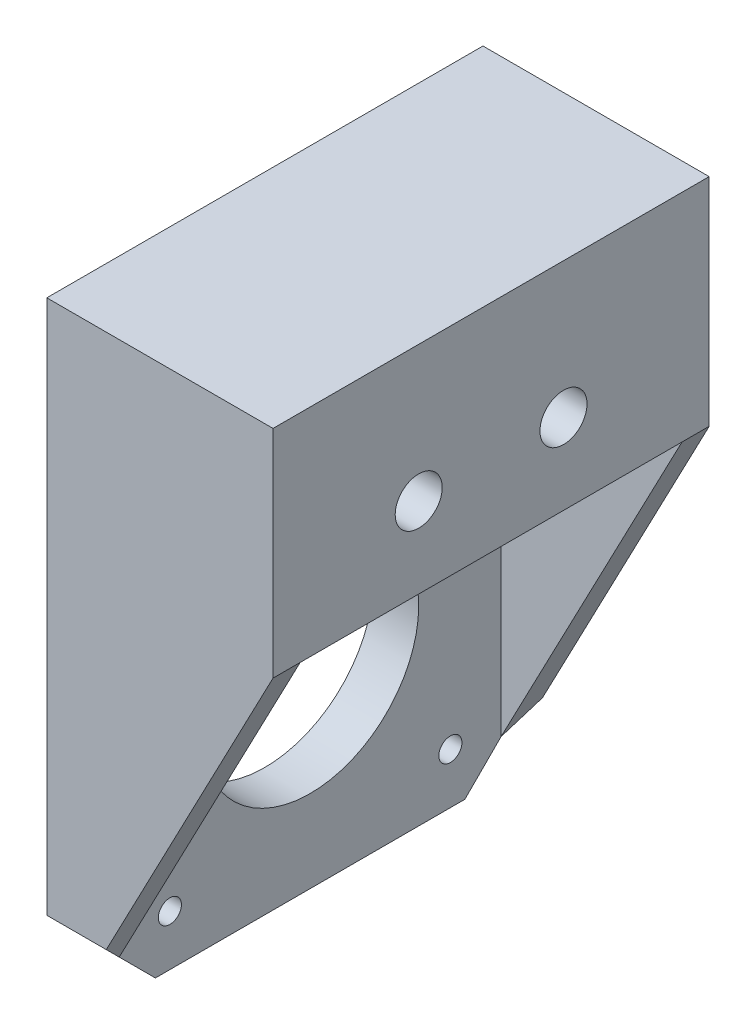
from build123d import *

# Parameters (mm, degrees)
SKETCH1_R           = 1.275
BOSS_EXTRUDE1_DEPTH = 5
SKETCH2_W           = 9.1
SKETCH2_H           = 17.8
BOSS_EXTRUDE2_DEPTH = 20
BOSS_EXTRUDE3_DEPTH = 3
CUT_EXTRUDE1_DEPTH  = 15
SKETCH7_W           = 24.2
SKETCH7_H           = 42.2
BOSS_EXTRUDE4_DEPTH = 5
SKETCH8_R           = 12
CUT_EXTRUDE3_DEPTH  = 5
SKETCH10_W          = 48.2
SKETCH10_H          = 17.8
BOSS_EXTRUDE5_DEPTH = 5
FILLET1_R           = 3
BOSS_EXTRUDE6_START = 6.1
BOSS_EXTRUDE6_DEPTH = 6.1
SKETCH13_R          = 2.6
CUT_EXTRUDE4_DEPTH  = 16
FILLET2_R           = 3
SKETCH14_W          = 25
SKETCH14_H          = 48.2
BOSS_EXTRUDE7_DEPTH = 5


with BuildPart() as part:
    # Sketch1 → Boss-Extrude1 (new body)
    # profile 1 of 2: a face of its own
    with BuildSketch(Plane(origin=(0, 0, 0), x_dir=(0, 0, -1), z_dir=(1, 0, 0))):
        Polygon((-4.381647728, -34.17856484), (-0.382647728, -30.17956484), (-0.382647728, 8.02143516), (-6.482647728, 8.02143516), (-9.382647728, 8.02143516), (-9.382647728, -34.17856484), align=None)
        with Locations((-5.982647728, 2.42143516)):
            Circle(SKETCH1_R, mode=Mode.SUBTRACT)
        with Locations((-5.982647728, -28.57856484)):
            Circle(SKETCH1_R, mode=Mode.SUBTRACT)
    # profile 2 of 2: a face of its own
    with BuildSketch(Plane(origin=(0, 0, 0), x_dir=(0, 0, -1), z_dir=(1, 0, 0))):
        Polygon((2.617352272, 8.02143516), (2.617352272, 25.82143516), (-6.482647728, 25.82143516), (-6.482647728, 8.02143516), (-0.382647728, 8.02143516), align=None)
    extrude(amount=BOSS_EXTRUDE1_DEPTH)

    # Sketch2 → Boss-Extrude2 (add)
    with BuildSketch(Plane(origin=(5, 0, 0), x_dir=(0, 0, -1), z_dir=(1, 0, 0))):
        with Locations((-1.932647728, 16.92143516)):
            Rectangle(SKETCH2_W, SKETCH2_H)
    extrude(amount=BOSS_EXTRUDE2_DEPTH)

    # Sketch3 → Boss-Extrude3 (add)
    with BuildSketch(Plane(origin=(0, 0, 0.382647728), x_dir=(-1, 0, 0), z_dir=(0, 0, -1))):
        Polygon((-25, 8.02143516), (0, 8.02143516), (0, -30.17956484), (-5, -30.17956484), align=None)
    extrude(amount=BOSS_EXTRUDE3_DEPTH)

    # Sketch4 → Cut-Extrude1 (cut, symmetric)
    with BuildSketch(Plane(origin=(5, 0, 0), x_dir=(0, 0, -1), z_dir=(1, 0, 0))):
        Polygon((-0.382647728, -30.17956484), (2.617352272, -27.17956484), (2.617352272, -30.17956484), align=None)
    extrude(amount=CUT_EXTRUDE1_DEPTH, both=True, mode=Mode.SUBTRACT)


with BuildPart() as body_2:
    # Mirror14: mirrored copy
    add(part.part.mirror(Plane.XY.offset(21.482647728)))


with BuildPart() as part_1:
    add(part.part)

    add(body_2.part)  # Boss-Extrude4 merges body 2
    # Sketch7 → Boss-Extrude4 (add)
    with BuildSketch(Plane(origin=(5, 0, 0), x_dir=(0, 0, -1), z_dir=(1, 0, 0))):
        with Locations((-21.482647728, -13.07856484)):
            Rectangle(SKETCH7_W, SKETCH7_H)
    extrude(amount=-BOSS_EXTRUDE4_DEPTH)

    # Sketch8 → Cut-Extrude3 (cut)
    with BuildSketch(Plane(origin=(5, 0, 0), x_dir=(0, 0, -1), z_dir=(1, 0, 0))):
        with Locations((-21.482647728, -13.07856484)):
            Circle(SKETCH8_R)
    extrude(amount=-CUT_EXTRUDE3_DEPTH, mode=Mode.SUBTRACT)

    # Sketch10 → Boss-Extrude5 (add)
    with BuildSketch(Plane(origin=(25, 0, 0), x_dir=(0, 0, -1), z_dir=(1, 0, 0))):
        with Locations((-21.482647728, 16.92143516)):
            Rectangle(SKETCH10_W, SKETCH10_H)
    extrude(amount=-BOSS_EXTRUDE5_DEPTH)

    # Fillet1
    fillet1_edges = [part_1.edges().sort_by_distance(p)[0] for p in [
        (20, 16.92143516, 36.482647728),
        (20, 16.92143516, 6.482647728),
    ]]
    fillet(fillet1_edges, radius=FILLET1_R)

    # Sketch12 → Boss-Extrude6 (add)
    with BuildSketch(Plane(origin=(0, 25.82143516, 0), x_dir=(1, 0, 0), z_dir=(0, 1, 0)).offset(BOSS_EXTRUDE6_START)):
        with BuildLine():
            Line((25, 2.617352272), (0, 2.617352272))
            Line((0, 2.617352272), (0, -6.482647728))
            Line((0, -6.482647728), (17, -6.482647728))
            ThreePointArc((17, -6.482647728), (19.121320344, -7.361327384), (20, -9.482647728))
            Line((20, -9.482647728), (20, -33.482647728))
            ThreePointArc((20, -33.482647728), (19.121320344, -35.603968072), (17, -36.482647728))
            Line((17, -36.482647728), (0, -36.482647728))
            Line((0, -36.482647728), (0, -45.582647728))
            Line((0, -45.582647728), (25, -45.582647728))
            Line((25, -45.582647728), (25, 2.617352272))
        make_face()
    extrude(amount=-BOSS_EXTRUDE6_DEPTH)

    # Sketch13 → Cut-Extrude4 (cut)
    with BuildSketch(Plane.ZY.offset(-20)):
        with Locations((29.482647728, 16.92143516)):
            Circle(SKETCH13_R)
        with Locations((13.482647728, 16.92143516)):
            Circle(SKETCH13_R)
    extrude(amount=-CUT_EXTRUDE4_DEPTH, mode=Mode.SUBTRACT)

    # Fillet2
    # the kernel refuses this fillet: 3 mm, written as the material it adds along each edge
    with BuildSketch(Plane(origin=(0, 8.02143516, 6.482647728), x_dir=(0, 1, 0), z_dir=(1, 0, 0)), Plane(origin=(0, 8.02143516, 36.482647728), x_dir=(0, 0, -1), z_dir=(1, 0, 0))) as fillet2_piece_1:
        with BuildLine():
            CenterArc((FILLET2_R, FILLET2_R), FILLET2_R, 180, 90)
            Line((0, FILLET2_R), (0, 0))
            Line((0, 0), (FILLET2_R, 0))
        make_face()
    extrude(amount=5)

    # Sketch14 → Boss-Extrude7 (add)
    with BuildSketch(Plane(origin=(0, 31.92143516, 0), x_dir=(1, 0, 0), z_dir=(0, 1, 0))):
        with Locations((12.5, -21.482647728)):
            Rectangle(SKETCH14_W, SKETCH14_H)
    extrude(amount=-BOSS_EXTRUDE7_DEPTH)


solid = part_1.part
